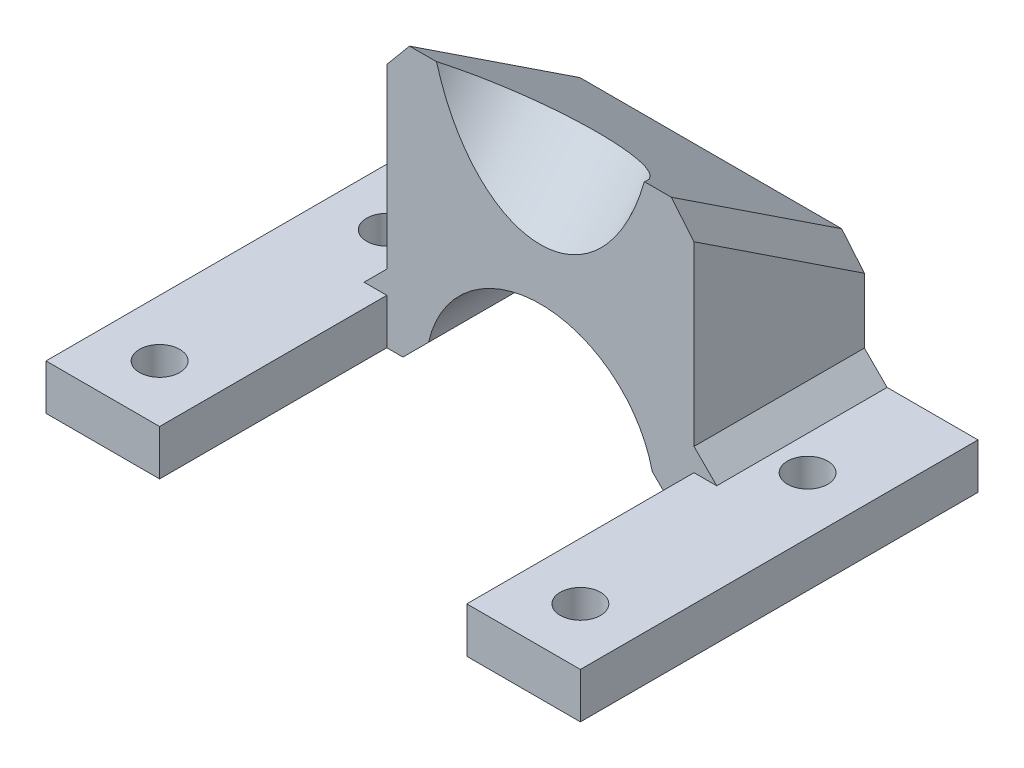
from build123d import *
from build123d.topology import SkipClean

# Parameters (mm, degrees)
BOSS_EXTRUDE1_DEPTH     = 50.8
SKETCH2_R               = 2.25
SKETCH2_R_2             = 2.2500000000000004
SKETCH2_R_3             = 2.2499999999999964
SKETCH2_R_4             = 2.250000000000002
CUT_EXTRUDE2_DEPTH      = 80.4629164554471
CUT_EXTRUDE4_DEPTH      = 80.4629164554471
CUT_EXTRUDE4_DEPTH_BACK = 80.4629164554471
SKETCH7_W               = 34.34264107490862
SKETCH7_H               = 6.349999999999994
SKETCH7_H_2             = 25.4
SKETCH7_W_2             = 12.699999999999996
BOSS_EXTRUDE3_START     = 12.7
BOSS_EXTRUDE3_DEPTH     = 34.342641075
CUT_EXTRUDE5_DEPTH      = 81.46127057538526
CUT_EXTRUDE5_DEPTH_BACK = 81.46127057538526
CAVITY1_START           = -12.110223167
CAVITY1_DEPTH           = 25.933177896
CHAMFER5_SIZE           = 2.54


with BuildPart() as part:
    # Sketch1 → Boss-Extrude1 (new body)
    with BuildSketch(Plane.XY):
        with BuildLine():
            Line((0, 5.08), (0, 0))
            Line((0, 0), (11.964320537454306, 0))
            ThreePointArc((11.964320537454306, 2.19e-15), (12.149194735731278, 2.56649684743677), (12.700000000000003, 5.080000000000005))
            Line((12.7, 5.08), (0, 5.08))
        make_face()
        with BuildLine():
            ThreePointArc((12.700000000000003, 5.080000000000005), (12.149194735731278, 2.56649684743677), (11.964320537454306, 2.19e-15))
            Line((11.964320537454306, 0), (17.044320537454304, 0))
            ThreePointArc((17.044320537454304, 1.57e-15), (20.80126185517433, 9.070058682279722), (29.871320537453954, 12.827000000000004))
            Line((29.871320537454306, 12.827000000000004), (29.871320537454306, 17.907))
            ThreePointArc((29.871320537454306, 17.907), (19.154672530731307, 14.34622265615587), (12.700000000000003, 5.080000000000005))
        make_face()
        with BuildLine():
            Line((42.69832053745431, 0), (47.778320537454306, 0))
            ThreePointArc((47.778320537454306, 0), (47.59344633917733, 2.56649684743677), (47.042641074908616, 5.079999999999999))
            ThreePointArc((47.042641074908616, 5.079999999999999), (40.5879685441773, 14.34622265615587), (29.871320537454306, 17.907))
            Line((29.871320537454306, 17.907), (29.871320537454306, 12.827000000000004))
            ThreePointArc((29.871320537453954, 12.827000000000004), (38.94137921973403, 9.070058682279972), (42.69832053745431, 0))
        make_face()
        with BuildLine():
            ThreePointArc((47.042641074908616, 5.079999999999999), (47.59344633917733, 2.56649684743677), (47.778320537454306, 0))
            Line((47.778320537454306, 0), (59.74264107490861, 0))
            Line((59.74264107490861, 0), (59.74264107490861, 5.08))
            Line((59.74264107490861, 5.08), (47.042641074908616, 5.08))
        make_face()
    extrude(amount=BOSS_EXTRUDE1_DEPTH)

    # Sketch2 → Cut-Extrude2 (cut, through all)
    with BuildSketch(Plane(origin=(0, 5.08, 0), x_dir=(1, 0, 0), z_dir=(0, 1, 0))):
        with Locations(Location((6.349999999999999, -12.7, 0), (0, 0, 270))):
            Circle(SKETCH2_R)
        with Locations(Location((6.350000000000002, -38.10000000000001, 0), (0, 0, 270))):
            Circle(SKETCH2_R_2)
        with Locations(Location((53.392641074908624, -38.1, 0), (0, 0, 270))):
            Circle(SKETCH2_R_3)
        with Locations(Location((53.39264107490862, -12.699999999999994, 0), (0, 0, 270))):
            Circle(SKETCH2_R_4)
    extrude(amount=-CUT_EXTRUDE2_DEPTH, mode=Mode.SUBTRACT)

    # Sketch7 → Cut-Extrude4 (cut, two sides: drawn at the far end of the back side and taken through both)
    with BuildSketch(Plane(origin=(0, 5.08, 0), x_dir=(1, 0, 0), z_dir=(0, 1, 0)).offset(-CUT_EXTRUDE4_DEPTH_BACK)):
        Polygon((0, -50.8), (12.700000000000001, -50.8), (12.7, -44.449999999999996), (0, -44.449999999999996), align=None)
        with Locations((29.871320537454306, -47.62499999999999)):
            Rectangle(SKETCH7_W, SKETCH7_H)
        with Locations((29.871320537454306, -31.749999999999996)):
            Rectangle(SKETCH7_W, SKETCH7_H_2)
        with Locations((53.39264107490861, -47.62499999999999)):
            Rectangle(SKETCH7_W_2, SKETCH7_H)
    extrude(amount=CUT_EXTRUDE4_DEPTH + CUT_EXTRUDE4_DEPTH_BACK, mode=Mode.SUBTRACT)

    # Sketch8 → Boss-Extrude3 (add)
    with BuildSketch(Plane(origin=(0, 0, 0), x_dir=(0, 0, -1), z_dir=(1, 0, 0)).offset(BOSS_EXTRUDE3_START)):
        Polygon((-19.049999999999997, 5.0799999999999965), (-19.049999999999994, 30.479999999999997), (0, 17.907), (0, 5.079999999999999), align=None)
    extrude(amount=BOSS_EXTRUDE3_DEPTH)

    # Sketch1<4> → Cut-Extrude5 (cut, two sides: drawn at the far end of the back side and taken through both)
    with SkipClean():  # the faces are left unmerged after this step: merging them gives an invalid solid
        with BuildSketch(Plane.XY.offset(-CUT_EXTRUDE5_DEPTH_BACK)):
            with BuildLine():
                ThreePointArc((29.871320537453954, 12.827000000000004), (20.80126185517433, 9.070058682279722), (17.044320537454304, 1.57e-15))
                Line((17.044320537454304, 0), (29.871320537454306, 0))
                Line((29.871320537454306, 0), (29.871320537454306, 12.827000000000004))
            make_face()
            with BuildLine():
                Line((29.871320537454306, 0), (17.044320537454304, 0))
                ThreePointArc((17.044320537454304, 1.57e-15), (29.871320537454302, -12.827000000000004), (42.69832053745431, -3.14e-15))
                ThreePointArc((42.69832053745431, 0), (38.94137921973403, 9.070058682279972), (29.871320537453954, 12.827000000000004))
                Line((29.871320537454306, 12.827000000000004), (29.871320537454306, 0))
            make_face()
        extrude(amount=CUT_EXTRUDE5_DEPTH + CUT_EXTRUDE5_DEPTH_BACK, mode=Mode.SUBTRACT)

    # Cavity1: read off the stored shape, not the designer's step
    # Cavity1 outline → Cavity1 (cut)
    with SkipClean():  # the faces are left unmerged after this step: merging them gives an invalid solid
        with BuildSketch(Plane(origin=(0, 0, 0), x_dir=(1, 0, 0), z_dir=(0, 0.7719302356170498, -0.6357072528610997)).offset(CAVITY1_START)):
            with BuildLine():
                Line((42.335603858, -36), (41.488040544, -34.081628056))
                ThreePointArc((41.488040544, -34.081628056), (29.871320538, -26.514055969), (18.254600531, -34.081628056))
                Line((18.254600531, -34.081628056), (17.407037217, -36))
                Line((17.407037217, -36), (42.335603858, -36))
            make_face()
        extrude(amount=CAVITY1_DEPTH, mode=Mode.SUBTRACT)

    # Chamfer5
    # the kernel refuses this chamfer: 2.54 mm, written as the material it adds along each edge
    with BuildSketch(Plane(origin=(12.700000000000003, 5.080000000000004, 0), x_dir=(-1, -1.4e-15, 0), z_dir=(0, 0, 1))) as chamfer5_piece_1:
        Polygon((CHAMFER5_SIZE, 0), (0, -CHAMFER5_SIZE), (0, 0), align=None)
    extrude(amount=19.049999999999997)
    with BuildSketch(Plane(origin=(47.042641074908616, 5.08, 0), x_dir=(3.598031758927257e-11, 1.0, 0), z_dir=(0, 0, 1))) as chamfer5_piece_2:
        Polygon((CHAMFER5_SIZE, 0), (9.139001e-11, -CHAMFER5_SIZE), (0, 0), align=None)
    extrude(amount=19.049999999999997)
    # the kernel refuses this chamfer: 2.54 mm, written as the material it takes off along each edge
    with BuildSketch(Plane(origin=(42.69832053745431, -1.3e-16, -7.4053740903902145), x_dir=(1, 5e-17, 0), z_dir=(0, 0, 1))) as chamfer5_2_piece_1:
        with BuildLine():
            Line((CHAMFER5_SIZE, 0), (-0.3237705210766462, 2.863770521075717))
            ThreePointArc((-0.3237705210766462, 2.863770521075717), (-0.08576469637885246, 1.4808281256642715), (0, 0))
            Line((0, 0), (CHAMFER5_SIZE, 0))
        make_face()
    extrude(amount=33.860748180780426, mode=Mode.SUBTRACT)
    with BuildSketch(Plane(origin=(17.044320537454304, 7.9e-16, -7.405374090390225), x_dir=(0.11234172985080312, 0.9936696310817439, 0), z_dir=(0, 0, 1))) as chamfer5_2_piece_2:
        with BuildLine():
            Line((2.882014737592532, 1e-17), (-CHAMFER5_SIZE * 0.112341729851, CHAMFER5_SIZE * 0.993669631082))
            Line((-CHAMFER5_SIZE * 0.112341729851, CHAMFER5_SIZE * 0.993669631082), (0, 0))
            ThreePointArc((0, 0), (1.4810888916756169, 0.0811370190382275), (2.882014737592532, 1e-17))
        make_face()
    extrude(amount=33.86074818078045, mode=Mode.SUBTRACT)
    with BuildSketch(Plane(origin=(47.042641075000006, 34.07814250199304, 24.501731063625822), x_dir=(-1, 6.4e-16, -4.2e-16), z_dir=(0, -0.5508422083307387, -0.8346094065617252))) as chamfer5_2_piece_3:
        Polygon((CHAMFER5_SIZE, 0), (-1.96e-15, -CHAMFER5_SIZE), (0, 0), align=None)
    extrude(amount=35.889197859210064, mode=Mode.SUBTRACT)
    with BuildSketch(Plane(origin=(12.7, 34.07814250199304, 24.50173106362582), x_dir=(0, -0.8346094065617252, 0.5508422083307387), z_dir=(0, -0.5508422083307387, -0.8346094065617252))) as chamfer5_2_piece_4:
        Polygon((CHAMFER5_SIZE, 0), (0, -CHAMFER5_SIZE), (0, 0), align=None)
    extrude(amount=35.88919785921006, mode=Mode.SUBTRACT)


solid = part.part
